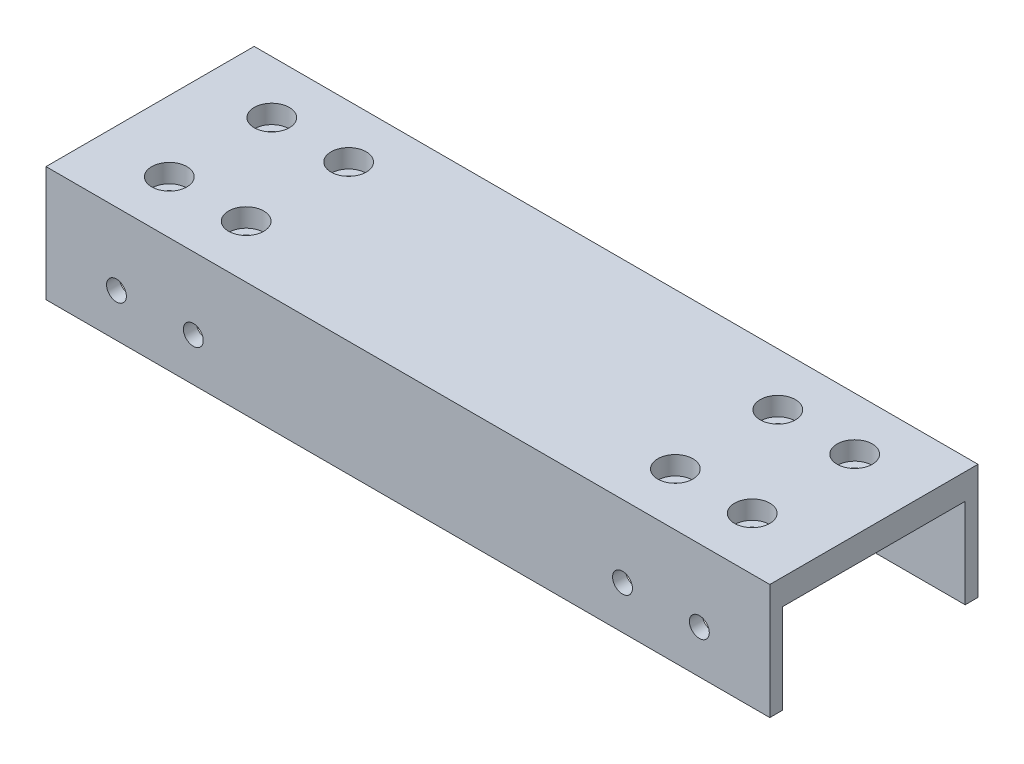
from build123d import *

# Parameters (mm, degrees)
SKETCH1_W                                            = 113
SKETCH1_H                                            = 32.5
BOSS_EXTRUDE1_DEPTH                                  = 4
CBORE_FOR_M2_5_HEX_SOCKET_HEAD_CAP_SCREW_D           = 2.9
CBORE_FOR_M2_5_HEX_SOCKET_HEAD_CAP_SCREW_CBORE_D     = 5.5
CBORE_FOR_M2_5_HEX_SOCKET_HEAD_CAP_SCREW_CBORE_DEPTH = 2.9
SKETCH5_W                                            = 113
SKETCH5_H                                            = 2
BOSS_EXTRUDE2_DEPTH                                  = 14
BOSS_EXTRUDE3_REACH                                  = 120.951
SKETCH7_W                                            = 44
SKETCH7_H                                            = 28.5
M2_5_CLEARANCE_HOLE1_D                               = 3.1
SKETCH11_W                                           = 36
SKETCH11_H                                           = 24.5
CUT_EXTRUDE1_DEPTH                                   = 14


with BuildPart() as part:
    # Sketch1 → Boss-Extrude1 (new body)
    with BuildSketch(Plane(origin=(0, 0, 0), x_dir=(1, 0, 0), z_dir=(0, 1, 0))):
        with Locations((56.5, 16.25)):
            Rectangle(SKETCH1_W, SKETCH1_H)
    extrude(amount=BOSS_EXTRUDE1_DEPTH)

    # CBORE for M2.5 Hex Socket Head Cap Screw1 (through all)
    with Locations(Plane(origin=(0, 4, 0), x_dir=(1, 0, 0), z_dir=(0, 1, 0))):
        with Locations((11, 24.25), (23, 24.25), (23, 8.25), (11, 8.25), (102, 8.25), (90, 8.25), (90, 24.25), (102, 24.25)):
            CounterBoreHole(CBORE_FOR_M2_5_HEX_SOCKET_HEAD_CAP_SCREW_D / 2, CBORE_FOR_M2_5_HEX_SOCKET_HEAD_CAP_SCREW_CBORE_D / 2, CBORE_FOR_M2_5_HEX_SOCKET_HEAD_CAP_SCREW_CBORE_DEPTH)

    # Sketch5 → Boss-Extrude2 (add)
    with BuildSketch(Plane.XZ):
        with Locations((56.5, -1)):
            Rectangle(SKETCH5_W, SKETCH5_H)
        with Locations((56.5, -31.5)):
            Rectangle(SKETCH5_W, SKETCH5_H)
    extrude(amount=BOSS_EXTRUDE2_DEPTH)

    # Sketch7 → Boss-Extrude3 (add, up to next)
    with BuildSketch(Plane.XZ.offset(14), mode=Mode.PRIVATE) as boss_extrude3_sk1:
        with Locations((56.5, -16.25)):
            Rectangle(SKETCH7_W, SKETCH7_H)
    boss_extrude3_tool1 = extrude(boss_extrude3_sk1.sketch, amount=-BOSS_EXTRUDE3_REACH, mode=Mode.PRIVATE) - part.part
    add(boss_extrude3_tool1.solids().sort_by_distance((56.5, -14, -16.25))[0])

    # M2.5 Clearance Hole1 (through all)
    with Locations(Plane(origin=(0, 0, -32.5), x_dir=(-1, 0, 0), z_dir=(0, 0, -1))):
        with Locations((-11, -7.25), (-23, -7.25), (-102, -7.25), (-90, -7.25)):
            Hole(M2_5_CLEARANCE_HOLE1_D / 2)

    # Sketch11 → Cut-Extrude1 (cut)
    with BuildSketch(Plane.XZ.offset(14)):
        with Locations((56.5, -16.25)):
            Rectangle(SKETCH11_W, SKETCH11_H)
    extrude(amount=-CUT_EXTRUDE1_DEPTH, mode=Mode.SUBTRACT)


solid = part.part
